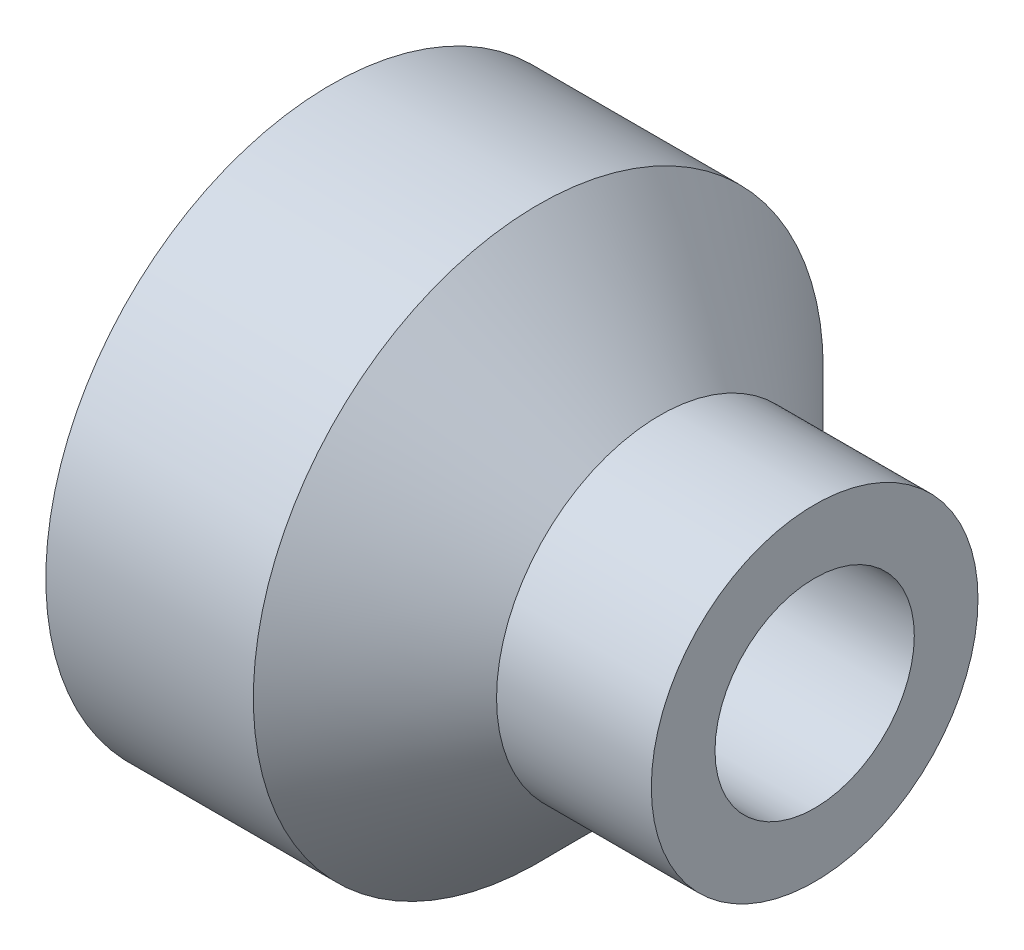
from build123d import *


with BuildPart() as part:
    # Sketch1 → Revolve1 (revolve)
    with BuildSketch(Plane.XY):
        Polygon((-3.56242049, 4.546), (-0.25157951, 4.546), (1.68842049, 2.606), (4.15757951, 2.606), (4.15757951, 1.59), (1.26757951, 1.59), (-0.67242049, 3.53), (-3.56242049, 3.53), align=None)
    revolve(axis=Axis((0, 0, 0), (-1, 0, 0)))


solid = part.part
